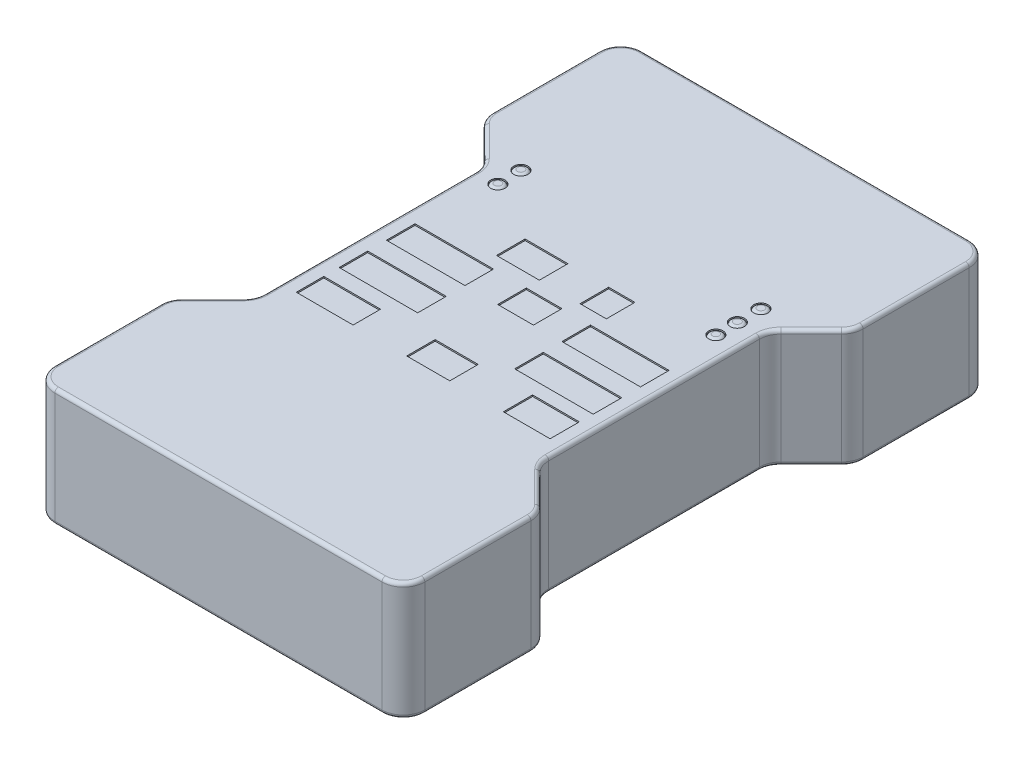
from build123d import *

# Parameters (mm, degrees)
Y_KSEKLIK_EKSTR_ZYON1_DEPTH  = 16.5
RADYUS1_R                    = 0.5
IZIM4_R                      = 1
IZIM4_R_2                    = 0.994654728
IZIM4_W                      = 6
IZIM4_H                      = 4
IZIM4_W_2                    = 7.950638325
IZIM4_H_2                    = 3.84534267
IZIM4_W_3                    = 6.545361945
IZIM4_H_3                    = 4.095070952
IZIM4_W_4                    = 6.031701882
IZIM4_H_4                    = 3.980953237
IZIM4_W_5                    = 10.994178329
IZIM4_W_6                    = 11
IZIM4_W_7                    = 10.994684561
IZIM4_W_8                    = 5
IZIM4_W_9                    = 3.675536493
KES_EKSTR_ZYON2_DEPTH        = 0.2
IZIM7_R                      = 0.945353226
Y_KSEKLIK_EKSTR_ZYON6_DEPTH  = 0.3
RADYUS6_R                    = 0.5
IZIM8_R                      = 0.920398329
Y_KSEKLIK_EKSTR_ZYON8_DEPTH  = 0.3
RADYUS7_R                    = 0.5
IZIM9_R                      = 0.945929805
Y_KSEKLIK_EKSTR_ZYON9_DEPTH  = 0.3
RADYUS8_R                    = 0.5
IZIM10_R                     = 0.949064343
Y_KSEKLIK_EKSTR_ZYON10_DEPTH = 0.3
RADYUS9_R                    = 0.5
IZIM11_R                     = 0.949481873
Y_KSEKLIK_EKSTR_ZYON11_DEPTH = 0.3
RADYUS10_R                   = 0.5


with BuildPart() as part:
    # Çizim2 → Yükseklik-Ekstrüzyon1 (new body)
    with BuildSketch(Plane(origin=(0, 0, 0), x_dir=(1, 0, 0), z_dir=(0, 1, 0))):
        with BuildLine():
            Line((-33.494534037, 38.947420014), (-33.494534037, 53.794779327))
            ThreePointArc((-33.494534037, 53.794779327), (-32.615854381, 55.91609967), (-30.494534037, 56.794779327))
            Line((-30.494534037, 56.794779327), (15.305465963, 56.794779327))
            ThreePointArc((15.305465963, 56.794779327), (17.426786307, 55.91609967), (18.305465963, 53.794779327))
            Line((18.305465963, 53.794779327), (18.305465963, 38.947420014))
            ThreePointArc((18.305465963, 38.947420014), (18.07710456, 37.799369717), (17.426786307, 36.82609967))
            Line((17.426786307, 36.82609967), (13.164145619, 32.563458983))
            ThreePointArc((13.164145619, 32.563458983), (12.513827365, 31.590188937), (12.285465963, 30.442138639))
            Line((12.285465963, 30.442138639), (12.285465963, 0.947420014))
            ThreePointArc((12.285465963, 0.947420014), (12.513827365, -0.200630283), (13.164145619, -1.17390033))
            Line((13.164145619, -1.17390033), (17.426786307, -5.436541017))
            ThreePointArc((17.426786307, -5.436541017), (18.07710456, -6.409811063), (18.305465963, -7.557861361))
            Line((18.305465963, -7.557861361), (18.305465963, -22.405220673))
            ThreePointArc((18.305465963, -22.405220673), (17.426786307, -24.526541017), (15.305465963, -25.405220673))
            Line((15.305465963, -25.405220673), (-30.494534037, -25.405220673))
            ThreePointArc((-30.494534037, -25.405220673), (-32.615854381, -24.526541017), (-33.494534037, -22.405220673))
            Line((-33.494534037, -22.405220673), (-33.494534037, -7.557861361))
            ThreePointArc((-33.494534037, -7.557861361), (-33.266172635, -6.409811063), (-32.615854381, -5.436541017))
            Line((-32.615854381, -5.436541017), (-28.353213693, -1.17390033))
            ThreePointArc((-28.353213693, -1.17390033), (-27.70289544, -0.200630283), (-27.474534037, 0.947420014))
            Line((-27.474534037, 0.947420014), (-27.474534037, 30.442138639))
            ThreePointArc((-27.474534037, 30.442138639), (-27.70289544, 31.590188937), (-28.353213693, 32.563458983))
            Line((-28.353213693, 32.563458983), (-32.615854381, 36.82609967))
            ThreePointArc((-32.615854381, 36.82609967), (-33.266172635, 37.799369717), (-33.494534037, 38.947420014))
        make_face()
    extrude(amount=Y_KSEKLIK_EKSTR_ZYON1_DEPTH)

    # Radyus1
    radyus1_edges = [part.edges().sort_by_distance(p)[0] for p in [
        (18.07710456, 16.5, -37.799369717),
        (18.305465963, 16.5, -46.37109967),
        (-33.266172635, 16.5, -37.799369717),
        (17.426786307, 16.5, -55.91609967),
        (-7.594534037, 16.5, -56.794779327),
        (-32.615854381, 16.5, -55.91609967),
        (-30.484534037, 16.5, -34.694779327),
        (-27.70289544, 16.5, -31.590188937),
        (-32.615854381, 0, -55.91609967),
        (-27.474534037, 16.5, -15.694779327),
        (-7.594534037, 0, -56.794779327),
        (17.426786307, 0, -55.91609967),
        (18.305465963, 0, -46.37109967),
        (18.07710456, 0, -37.799369717),
        (15.295465963, 0, -34.694779327),
        (12.513827365, 0, -31.590188937),
        (12.285465963, 0, -15.694779327),
        (12.513827365, 0, 0.200630283),
        (15.295465963, 0, 3.305220673),
        (18.07710456, 0, 6.409811063),
        (-27.70289544, 16.5, 0.200630283),
        (18.305465963, 0, 14.981541017),
        (17.426786307, 0, 24.526541017),
        (-7.594534037, 0, 25.405220673),
        (-32.615854381, 0, 24.526541017),
        (-33.494534037, 0, 14.981541017),
        (-33.266172635, 0, 6.409811063),
        (-30.484534037, 0, 3.305220673),
        (-27.70289544, 0, 0.200630283),
        (-27.474534037, 0, -15.694779327),
        (-27.70289544, 0, -31.590188937),
        (-30.484534037, 16.5, 3.305220673),
        (-30.484534037, 0, -34.694779327),
        (-33.266172635, 0, -37.799369717),
        (-33.494534037, 0, -46.37109967),
        (-33.266172635, 16.5, 6.409811063),
        (-33.494534037, 16.5, 14.981541017),
        (-32.615854381, 16.5, 24.526541017),
        (-7.594534037, 16.5, 25.405220673),
        (-33.494534037, 16.5, -46.37109967),
        (17.426786307, 16.5, 24.526541017),
        (18.305465963, 16.5, 14.981541017),
        (18.07710456, 16.5, 6.409811063),
        (15.295465963, 16.5, 3.305220673),
        (12.513827365, 16.5, 0.200630283),
        (12.285465963, 16.5, -15.694779327),
        (12.513827365, 16.5, -31.590188937),
        (15.295465963, 16.5, -34.694779327),
    ]]
    fillet(radyus1_edges, radius=RADYUS1_R)

    # Çizim4 → Kes-Ekstrüzyon2 (cut)
    with BuildSketch(Plane(origin=(0, 16.5, 0), x_dir=(1, 0, 0), z_dir=(0, 1, 0))):
        with Locations(Location((9.210811234, 30.442138639, 0), (0, 0, 270))):
            Circle(IZIM4_R)
        with Locations(Location((9.205465963, 33.739868004, 0), (0, 0, 270))):
            Circle(IZIM4_R)
        with Locations(Location((9.210811234, 27.430789178, 0), (0, 0, 270))):
            Circle(IZIM4_R_2)
        with Locations(Location((-24.395783967, 33.739868004, 0), (0, 0, 270))):
            Circle(IZIM4_R)
        with Locations(Location((-24.322236189, 30.442138639, 0), (0, 0, 270))):
            Circle(IZIM4_R)
        with Locations((-12.774001102, 23.70385152)):
            Rectangle(IZIM4_W, IZIM4_H)
        with Locations((-21.346917027, 5.152516883)):
            Rectangle(IZIM4_W_2, IZIM4_H_2)
        with Locations((6.932784991, 5.277381024)):
            Rectangle(IZIM4_W_3, IZIM4_H_3)
        with Locations((-6.855746923, 5.220322167)):
            Rectangle(IZIM4_W_4, IZIM4_H_4)
        with Locations((-19.825147025, 11.225833129)):
            Rectangle(IZIM4_W_5, IZIM4_H)
        with Locations((4.744484602, 11.225833129)):
            Rectangle(IZIM4_W_6, IZIM4_H)
        with Locations((-19.824893909, 17.843043802)):
            Rectangle(IZIM4_W_7, IZIM4_H)
        with Locations((4.744484602, 17.843043802)):
            Rectangle(IZIM4_W_6, IZIM4_H)
        with Locations((-7.243006902, 17.843043802)):
            Rectangle(IZIM4_W_8, IZIM4_H)
        with Locations((-2.234577663, 23.70385152)):
            Rectangle(IZIM4_W_9, IZIM4_H)
    extrude(amount=-KES_EKSTR_ZYON2_DEPTH, mode=Mode.SUBTRACT)

    # Çizim7 → Yükseklik-Ekstrüzyon6 (add)
    with BuildSketch(Plane(origin=(0, 16.3, 0), x_dir=(1, 0, 0), z_dir=(0, 1, 0))):
        with Locations(Location((9.210811234, 30.442138639, 0), (0, 0, 270))):
            Circle(IZIM7_R)
    extrude(amount=Y_KSEKLIK_EKSTR_ZYON6_DEPTH)

    # Radyus6
    # the kernel refuses this fillet: 0.5 mm, written as the material it takes off along each edge
    with BuildSketch(Plane(origin=(9.210811234, 16.6, -30.442138639), x_dir=(0, 0, 1), z_dir=(-1, 0, 0))) as radyus6_piece_1:
        with BuildLine():
            CenterArc((0.487095656, -0.5), RADYUS6_R, 23.578178478, 66.421821522)
            Line((0.487095656, 0), (0.487095656, 0.01))
            Line((0.487095656, 0.01), (0.945353226, 0.01))
            Line((0.945353226, 0.01), (0.955353226, 0))
            ThreePointArc((0.955353226, 0), (0.955353226, -0.15), (0.954518377, -0.296))
            Line((0.954518377, -0.296), (0.945353226, -0.3))
        make_face()
    revolve(axis=Axis((9.210811234, 16.6, -30.442138639), (0, 1, 0)), mode=Mode.SUBTRACT)

    # Çizim8 → Yükseklik-Ekstrüzyon8 (add)
    with BuildSketch(Plane(origin=(0, 16.3, 0), x_dir=(1, 0, 0), z_dir=(0, 1, 0))):
        with Locations(Location((9.210811234, 27.430789178, 0), (0, 0, 270))):
            Circle(IZIM8_R)
    extrude(amount=Y_KSEKLIK_EKSTR_ZYON8_DEPTH)

    # Radyus7
    # the kernel refuses this fillet: 0.5 mm, written as the material it takes off along each edge
    with BuildSketch(Plane(origin=(9.210811234, 16.6, -27.430789178), x_dir=(0, 0, 1), z_dir=(-1, 0, 0))) as radyus7_piece_1:
        with BuildLine():
            CenterArc((0.462140759, -0.5), RADYUS7_R, 23.578178478, 66.421821522)
            Line((0.462140759, 0), (0.462140759, 0.01))
            Line((0.462140759, 0.01), (0.920398329, 0.01))
            Line((0.920398329, 0.01), (0.930398329, 0))
            ThreePointArc((0.930398329, 0), (0.930398329, -0.15), (0.92956348, -0.296))
            Line((0.92956348, -0.296), (0.920398329, -0.3))
        make_face()
    revolve(axis=Axis((9.210811234, 16.6, -27.430789178), (0, 1, 0)), mode=Mode.SUBTRACT)

    # Çizim9 → Yükseklik-Ekstrüzyon9 (add)
    with BuildSketch(Plane(origin=(0, 16.3, 0), x_dir=(1, 0, 0), z_dir=(0, 1, 0))):
        with Locations(Location((-24.322236189, 30.442138639, 0), (0, 0, 270))):
            Circle(IZIM9_R)
    extrude(amount=Y_KSEKLIK_EKSTR_ZYON9_DEPTH)

    # Radyus8
    # the kernel refuses this fillet: 0.5 mm, written as the material it takes off along each edge
    with BuildSketch(Plane(origin=(-24.322236189, 16.6, -30.442138639), x_dir=(0, 0, 1), z_dir=(-1, 0, 0))) as radyus8_piece_1:
        with BuildLine():
            CenterArc((0.487672235, -0.5), RADYUS8_R, 23.578178478, 66.421821522)
            Line((0.487672235, 0), (0.487672235, 0.01))
            Line((0.487672235, 0.01), (0.945929805, 0.01))
            Line((0.945929805, 0.01), (0.955929805, 0))
            ThreePointArc((0.955929805, 0), (0.955929805, -0.15), (0.955094956, -0.296))
            Line((0.955094956, -0.296), (0.945929805, -0.3))
        make_face()
    revolve(axis=Axis((-24.322236189, 16.6, -30.442138639), (0, 1, 0)), mode=Mode.SUBTRACT)

    # Çizim10 → Yükseklik-Ekstrüzyon10 (add)
    with BuildSketch(Plane(origin=(0, 16.3, 0), x_dir=(1, 0, 0), z_dir=(0, 1, 0))):
        with Locations(Location((-24.395783967, 33.739868004, 0), (0, 0, 270))):
            Circle(IZIM10_R)
    extrude(amount=Y_KSEKLIK_EKSTR_ZYON10_DEPTH)

    # Radyus9
    # the kernel refuses this fillet: 0.5 mm, written as the material it takes off along each edge
    with BuildSketch(Plane(origin=(-24.395783967, 16.6, -33.739868004), x_dir=(0, 0, 1), z_dir=(-1, 0, 0))) as radyus9_piece_1:
        with BuildLine():
            CenterArc((0.490806774, -0.5), RADYUS9_R, 23.578178478, 66.421821522)
            Line((0.490806774, 0), (0.490806774, 0.01))
            Line((0.490806774, 0.01), (0.949064343, 0.01))
            Line((0.949064343, 0.01), (0.959064343, 0))
            ThreePointArc((0.959064343, 0), (0.959064343, -0.15), (0.958229494, -0.296))
            Line((0.958229494, -0.296), (0.949064343, -0.3))
        make_face()
    revolve(axis=Axis((-24.395783967, 16.6, -33.739868004), (0, 1, 0)), mode=Mode.SUBTRACT)

    # Çizim11 → Yükseklik-Ekstrüzyon11 (add)
    with BuildSketch(Plane(origin=(0, 16.3, 0), x_dir=(1, 0, 0), z_dir=(0, 1, 0))):
        with Locations(Location((9.205465963, 33.739868004, 0), (0, 0, 270))):
            Circle(IZIM11_R)
    extrude(amount=Y_KSEKLIK_EKSTR_ZYON11_DEPTH)

    # Radyus10
    # the kernel refuses this fillet: 0.5 mm, written as the material it takes off along each edge
    with BuildSketch(Plane(origin=(9.205465963, 16.6, -33.739868004), x_dir=(0, 0, 1), z_dir=(-1, 0, 0))) as radyus10_piece_1:
        with BuildLine():
            CenterArc((0.491224304, -0.5), RADYUS10_R, 23.578178478, 66.421821522)
            Line((0.491224304, 0), (0.491224304, 0.01))
            Line((0.491224304, 0.01), (0.949481873, 0.01))
            Line((0.949481873, 0.01), (0.959481873, 0))
            ThreePointArc((0.959481873, 0), (0.959481873, -0.15), (0.958647025, -0.296))
            Line((0.958647025, -0.296), (0.949481873, -0.3))
        make_face()
    revolve(axis=Axis((9.205465963, 16.6, -33.739868004), (0, 1, 0)), mode=Mode.SUBTRACT)


solid = part.part
